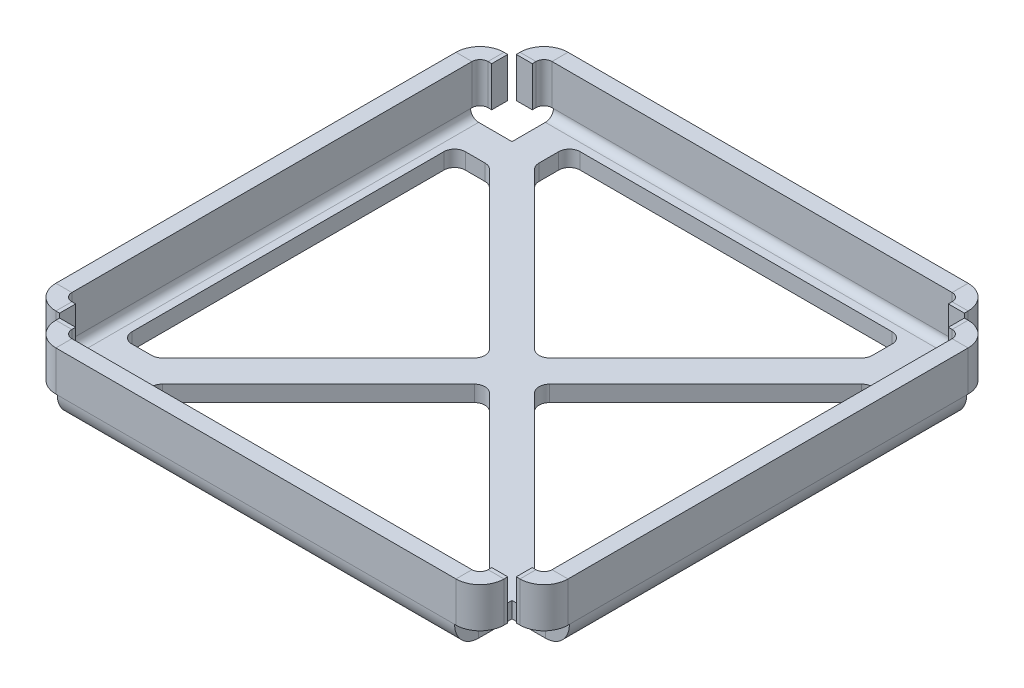
from build123d import *

# Parameters (mm, degrees)
BASE_FLANGE1_DEPTH             = 3
FILLET1_R                      = 2
EDGE_FLANGE1_STRIP_W           = 15
EDGE_FLANGE1_STRIP_H           = 3
EDGE_FLANGE1_STRIP_CUT_DEPTH   = 74.48
EDGE_FLANGE1_STRIP_2_W         = 15
EDGE_FLANGE1_STRIP_2_H         = 3
EDGE_FLANGE1_STRIP_CUT_2_DEPTH = 74.48
EDGE_FLANGE1_STRIP_3_W         = 15
EDGE_FLANGE1_STRIP_3_H         = 3
EDGE_FLANGE1_STRIP_CUT_3_DEPTH = 74.48
EDGE_FLANGE1_STRIP_4_W         = 15
EDGE_FLANGE1_STRIP_4_H         = 3
EDGE_FLANGE1_STRIP_CUT_4_DEPTH = 74.48
EDGE_FLANGE1_DEPTH             = 74.48
EDGE_FLANGE1_BEND_DEPTH        = 74.48
EDGE_FLANGE1_BEND_2_DEPTH      = 74.48
EDGE_FLANGE1_BEND_3_DEPTH      = 74.48
EDGE_FLANGE2_DEPTH             = 7.5
EDGE_FLANGE2_BEND_DEPTH        = 7.5
EDGE_FLANGE2_BEND_2_DEPTH      = 7.5
EDGE_FLANGE2_BEND_3_DEPTH      = 7.5
EDGE_FLANGE2_BEND_4_DEPTH      = 7.5
EDGE_FLANGE2_BEND_5_DEPTH      = 7.5
EDGE_FLANGE2_BEND_6_DEPTH      = 7.5
EDGE_FLANGE2_BEND_7_DEPTH      = 7.5


# Sheet-metal steps are written as plain solids
with BuildPart() as part:
    # Sketch1 → Base-Flange1 (new body)
    with BuildSketch(Plane(origin=(0, 0, 0), x_dir=(1, 0, 0), z_dir=(0, 1, 0))):
        Polygon((-50, 39.24), (-39.24, 39.24), (-39.24, 50), (35.24, 50), (35.24, 39.24), (46, 39.24), (46, -35.24), (35.24, -35.24), (35.24, -46), (-39.24, -46), (-39.24, -35.24), (-50, -35.24), align=None)
        Polygon((-37.482640687, 33.24), (-6.242640687, 2), (-37.482640687, -29.24), (-44, -29.24), (-44, 33.24), align=None, mode=Mode.SUBTRACT)
        Polygon((-33.24, 37.482640687), (-2, 6.242640687), (29.24, 37.482640687), (29.24, 44), (-33.24, 44), align=None, mode=Mode.SUBTRACT)
        Polygon((33.482640687, 33.24), (2.242640687, 2), (33.482640687, -29.24), (40, -29.24), (40, 33.24), align=None, mode=Mode.SUBTRACT)
        Polygon((-33.24, -40), (-33.24, -33.482640687), (-2, -2.242640687), (29.24, -33.482640687), (29.24, -40), align=None, mode=Mode.SUBTRACT)
    extrude(amount=-BASE_FLANGE1_DEPTH)

    # Fillet1
    fillet1_edges = [part.edges().sort_by_distance(p)[0] for p in [
        (29.24, -1.5, -44),
        (29.24, -1.5, -37.482640687),
        (-2, -1.5, -6.242640687),
        (-33.24, -1.5, -37.482640687),
        (-33.24, -1.5, -44),
        (-44, -1.5, 29.24),
        (-44, -1.5, -33.24),
        (-37.482640687, -1.5, -33.24),
        (-6.242640687, -1.5, -2),
        (-37.482640687, -1.5, 29.24),
        (29.24, -1.5, 40),
        (-33.24, -1.5, 40),
        (-33.24, -1.5, 33.482640687),
        (-2, -1.5, 2.242640687),
        (29.24, -1.5, 33.482640687),
        (40, -1.5, -33.24),
        (40, -1.5, 29.24),
        (33.482640687, -1.5, 29.24),
        (2.242640687, -1.5, -2),
        (33.482640687, -1.5, -33.24),
    ]]
    fillet(fillet1_edges, radius=FILLET1_R)

    # Edge-Flange1 strip (across the edge) → Edge-Flange1 strip cut (cut)
    with BuildSketch(Plane(origin=(-50, 0, -39.24), x_dir=(1, 0, 0), z_dir=(0, 0, 1))):
        with Locations((-3, -1.5)):
            Rectangle(EDGE_FLANGE1_STRIP_W, EDGE_FLANGE1_STRIP_H)
    extrude(amount=EDGE_FLANGE1_STRIP_CUT_DEPTH, mode=Mode.SUBTRACT)

    # Edge-Flange1 strip 2 (across the edge) → Edge-Flange1 strip cut 2 (cut)
    with BuildSketch(Plane(origin=(46, 0, 35.24), x_dir=(-1, 0, 0), z_dir=(0, 0, -1))):
        with Locations((-3, -1.5)):
            Rectangle(EDGE_FLANGE1_STRIP_2_W, EDGE_FLANGE1_STRIP_2_H)
    extrude(amount=EDGE_FLANGE1_STRIP_CUT_2_DEPTH, mode=Mode.SUBTRACT)

    # Edge-Flange1 strip 3 (across the edge) → Edge-Flange1 strip cut 3 (cut)
    with BuildSketch(Plane(origin=(-39.24, 0, 46), x_dir=(0, 0, -1), z_dir=(1, 0, 0))):
        with Locations((-3, -1.5)):
            Rectangle(EDGE_FLANGE1_STRIP_3_W, EDGE_FLANGE1_STRIP_3_H)
    extrude(amount=EDGE_FLANGE1_STRIP_CUT_3_DEPTH, mode=Mode.SUBTRACT)

    # Edge-Flange1 strip 4 (across the edge) → Edge-Flange1 strip cut 4 (cut)
    with BuildSketch(Plane(origin=(35.24, 0, -50), x_dir=(0, 0, 1), z_dir=(-1, 0, 0))):
        with Locations((-3, -1.5)):
            Rectangle(EDGE_FLANGE1_STRIP_4_W, EDGE_FLANGE1_STRIP_4_H)
    extrude(amount=EDGE_FLANGE1_STRIP_CUT_4_DEPTH, mode=Mode.SUBTRACT)

    # Edge-Flange1 section (across the edge) → Edge-Flange1 (add)
    with BuildSketch(Plane(origin=(-50, 0, -39.24), x_dir=(1, 0, 0), z_dir=(0, 0, 1))):
        with BuildLine():
            Line((0, 1.5), (0, 9))
            Line((0, 9), (3, 9))
            Line((3, 9), (3, 1.5))
            ThreePointArc((3, 1.5), (3.439339828, 0.439339828), (4.5, 0))
            Line((4.5, 0), (4.5, -3))
            ThreePointArc((4.5, -3), (1.318019485, -1.681980515), (0, 1.5))
        make_face()
    extrude(amount=EDGE_FLANGE1_DEPTH)

    # Edge-Flange1 section 2 (across the edge) → Edge-Flange1 bend (add)
    with BuildSketch(Plane(origin=(46, 0, 35.24), x_dir=(-1, 0, 0), z_dir=(0, 0, -1))):
        with BuildLine():
            Line((0, 1.5), (0, 9))
            Line((0, 9), (3, 9))
            Line((3, 9), (3, 1.5))
            ThreePointArc((3, 1.5), (3.439339828, 0.439339828), (4.5, 0))
            Line((4.5, 0), (4.5, -3))
            ThreePointArc((4.5, -3), (1.318019485, -1.681980515), (0, 1.5))
        make_face()
    extrude(amount=EDGE_FLANGE1_BEND_DEPTH)

    # Edge-Flange1 section 3 (across the edge) → Edge-Flange1 bend 2 (add)
    with BuildSketch(Plane(origin=(-39.24, 0, 46), x_dir=(0, 0, -1), z_dir=(1, 0, 0))):
        with BuildLine():
            Line((0, 1.5), (0, 9))
            Line((0, 9), (3, 9))
            Line((3, 9), (3, 1.5))
            ThreePointArc((3, 1.5), (3.439339828, 0.439339828), (4.5, 0))
            Line((4.5, 0), (4.5, -3))
            ThreePointArc((4.5, -3), (1.318019485, -1.681980515), (0, 1.5))
        make_face()
    extrude(amount=EDGE_FLANGE1_BEND_2_DEPTH)

    # Edge-Flange1 section 4 (across the edge) → Edge-Flange1 bend 3 (add)
    with BuildSketch(Plane(origin=(35.24, 0, -50), x_dir=(0, 0, 1), z_dir=(-1, 0, 0))):
        with BuildLine():
            Line((0, 1.5), (0, 9))
            Line((0, 9), (3, 9))
            Line((3, 9), (3, 1.5))
            ThreePointArc((3, 1.5), (3.439339828, 0.439339828), (4.5, 0))
            Line((4.5, 0), (4.5, -3))
            ThreePointArc((4.5, -3), (1.318019485, -1.681980515), (0, 1.5))
        make_face()
    extrude(amount=EDGE_FLANGE1_BEND_3_DEPTH)

    # Edge-Flange2 section (across the edge) → Edge-Flange2 (add)
    with BuildSketch(Plane(origin=(43, 9, -41), x_dir=(0, 0, 1), z_dir=(0, -1, 0))):
        with BuildLine():
            Line((-3, 1.5), (-3, 2.2))
            Line((-3, 2.2), (0, 2.2))
            Line((0, 2.2), (0, 1.5))
            ThreePointArc((0, 1.5), (0.439339828, 0.439339828), (1.5, 0))
            Line((1.5, 0), (1.76, 0))
            Line((1.76, 0), (1.76, -3))
            Line((1.76, -3), (1.5, -3))
            ThreePointArc((1.5, -3), (-1.681980515, -1.681980515), (-3, 1.5))
        make_face()
    extrude(amount=EDGE_FLANGE2_DEPTH)

    # Edge-Flange2 section 2 (across the edge) → Edge-Flange2 bend (add)
    with BuildSketch(Plane(origin=(37, 1.5, -47), x_dir=(-1, 0, 0), z_dir=(0, 1, 0))):
        with BuildLine():
            Line((-3, 1.5), (-3, 2.2))
            Line((-3, 2.2), (0, 2.2))
            Line((0, 2.2), (0, 1.5))
            ThreePointArc((0, 1.5), (0.439339828, 0.439339828), (1.5, 0))
            Line((1.5, 0), (1.76, 0))
            Line((1.76, 0), (1.76, -3))
            Line((1.76, -3), (1.5, -3))
            ThreePointArc((1.5, -3), (-1.681980515, -1.681980515), (-3, 1.5))
        make_face()
    extrude(amount=EDGE_FLANGE2_BEND_DEPTH)

    # Edge-Flange2 section 3 (across the edge) → Edge-Flange2 bend 2 (add)
    with BuildSketch(Plane(origin=(-41, 9, -47), x_dir=(1, 0, 0), z_dir=(0, -1, 0))):
        with BuildLine():
            Line((-3, 1.5), (-3, 2.2))
            Line((-3, 2.2), (0, 2.2))
            Line((0, 2.2), (0, 1.5))
            ThreePointArc((0, 1.5), (0.439339828, 0.439339828), (1.5, 0))
            Line((1.5, 0), (1.76, 0))
            Line((1.76, 0), (1.76, -3))
            Line((1.76, -3), (1.5, -3))
            ThreePointArc((1.5, -3), (-1.681980515, -1.681980515), (-3, 1.5))
        make_face()
    extrude(amount=EDGE_FLANGE2_BEND_2_DEPTH)

    # Edge-Flange2 section 4 (across the edge) → Edge-Flange2 bend 3 (add)
    with BuildSketch(Plane(origin=(-47, 1.5, -41), x_dir=(0, 0, 1), z_dir=(0, 1, 0))):
        with BuildLine():
            Line((-3, 1.5), (-3, 2.2))
            Line((-3, 2.2), (0, 2.2))
            Line((0, 2.2), (0, 1.5))
            ThreePointArc((0, 1.5), (0.439339828, 0.439339828), (1.5, 0))
            Line((1.5, 0), (1.76, 0))
            Line((1.76, 0), (1.76, -3))
            Line((1.76, -3), (1.5, -3))
            ThreePointArc((1.5, -3), (-1.681980515, -1.681980515), (-3, 1.5))
        make_face()
    extrude(amount=EDGE_FLANGE2_BEND_3_DEPTH)

    # Edge-Flange2 section 5 (across the edge) → Edge-Flange2 bend 4 (add)
    with BuildSketch(Plane(origin=(-47, 9, 37), x_dir=(0, 0, -1), z_dir=(0, -1, 0))):
        with BuildLine():
            Line((-3, 1.5), (-3, 2.2))
            Line((-3, 2.2), (0, 2.2))
            Line((0, 2.2), (0, 1.5))
            ThreePointArc((0, 1.5), (0.439339828, 0.439339828), (1.5, 0))
            Line((1.5, 0), (1.76, 0))
            Line((1.76, 0), (1.76, -3))
            Line((1.76, -3), (1.5, -3))
            ThreePointArc((1.5, -3), (-1.681980515, -1.681980515), (-3, 1.5))
        make_face()
    extrude(amount=EDGE_FLANGE2_BEND_4_DEPTH)

    # Edge-Flange2 section 6 (across the edge) → Edge-Flange2 bend 5 (add)
    with BuildSketch(Plane(origin=(-41, 1.5, 43), x_dir=(1, 0, 0), z_dir=(0, 1, 0))):
        with BuildLine():
            Line((-3, 1.5), (-3, 2.2))
            Line((-3, 2.2), (0, 2.2))
            Line((0, 2.2), (0, 1.5))
            ThreePointArc((0, 1.5), (0.439339828, 0.439339828), (1.5, 0))
            Line((1.5, 0), (1.76, 0))
            Line((1.76, 0), (1.76, -3))
            Line((1.76, -3), (1.5, -3))
            ThreePointArc((1.5, -3), (-1.681980515, -1.681980515), (-3, 1.5))
        make_face()
    extrude(amount=EDGE_FLANGE2_BEND_5_DEPTH)

    # Edge-Flange2 section 7 (across the edge) → Edge-Flange2 bend 6 (add)
    with BuildSketch(Plane(origin=(37, 9, 43), x_dir=(-1, 0, 0), z_dir=(0, -1, 0))):
        with BuildLine():
            Line((-3, 1.5), (-3, 2.2))
            Line((-3, 2.2), (0, 2.2))
            Line((0, 2.2), (0, 1.5))
            ThreePointArc((0, 1.5), (0.439339828, 0.439339828), (1.5, 0))
            Line((1.5, 0), (1.76, 0))
            Line((1.76, 0), (1.76, -3))
            Line((1.76, -3), (1.5, -3))
            ThreePointArc((1.5, -3), (-1.681980515, -1.681980515), (-3, 1.5))
        make_face()
    extrude(amount=EDGE_FLANGE2_BEND_6_DEPTH)

    # Edge-Flange2 section 8 (across the edge) → Edge-Flange2 bend 7 (add)
    with BuildSketch(Plane(origin=(43, 1.5, 37), x_dir=(0, 0, -1), z_dir=(0, 1, 0))):
        with BuildLine():
            Line((-3, 1.5), (-3, 2.2))
            Line((-3, 2.2), (0, 2.2))
            Line((0, 2.2), (0, 1.5))
            ThreePointArc((0, 1.5), (0.439339828, 0.439339828), (1.5, 0))
            Line((1.5, 0), (1.76, 0))
            Line((1.76, 0), (1.76, -3))
            Line((1.76, -3), (1.5, -3))
            ThreePointArc((1.5, -3), (-1.681980515, -1.681980515), (-3, 1.5))
        make_face()
    extrude(amount=EDGE_FLANGE2_BEND_7_DEPTH)


solid = part.part
